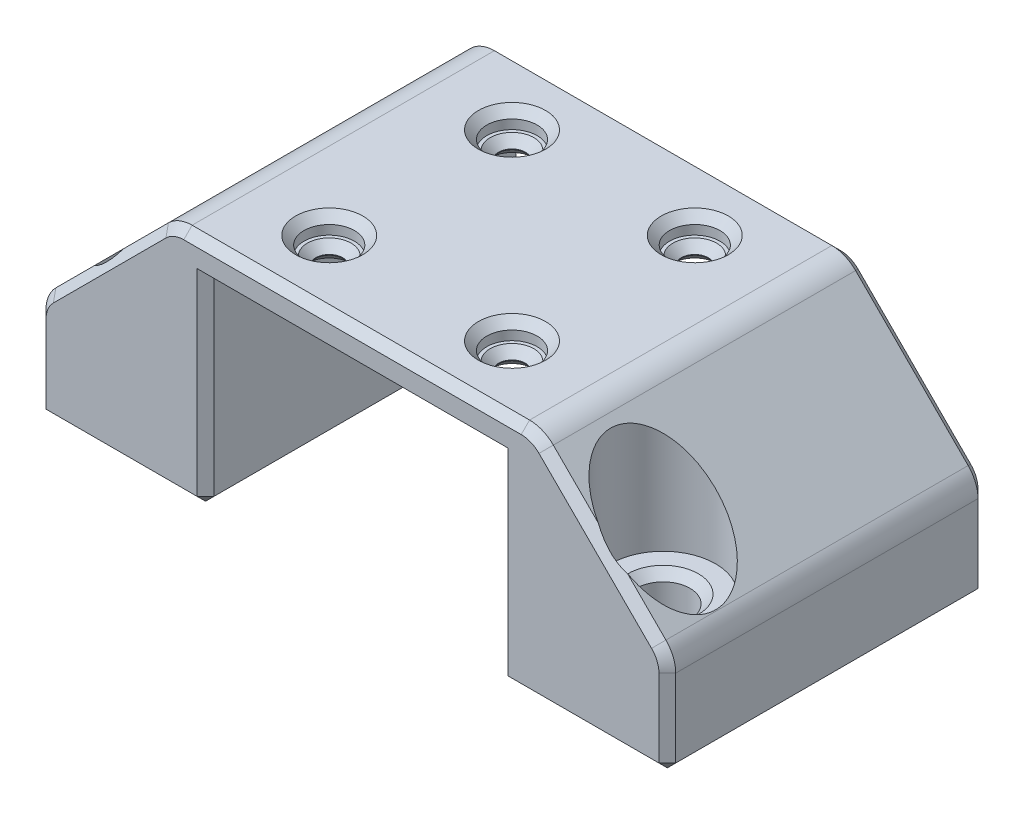
from build123d import *

# Parameters (mm, degrees)
BOSS_EXTRUDE1_DEPTH = 24.13
CHAMFER1_SIZE       = 10
FILLET1_R           = 2.54
FILLET2_R           = 2.54
SKETCH2_R           = 2.032
CUT_EXTRUDE1_DEPTH  = 10.16
SKETCH3_R           = 1.016
CUT_EXTRUDE2_DEPTH  = 39.185845946
SKETCH4_R           = 1.905
CUT_EXTRUDE3_DEPTH  = 1.3335
SKETCH5_R           = 2.032
CUT_EXTRUDE4_DEPTH  = 8.89
SKETCH7_R           = 3.96875
CUT_EXTRUDE5_DEPTH  = 10.16


with BuildPart() as part:
    # Sketch1 → Boss-Extrude1 (new body)
    with BuildSketch(Plane.XY):
        Polygon((-11.1125, 0), (-11.1125, 14.9225), (11.1125, 14.9225), (11.1125, 0), (23.8125, 0), (23.8125, 17.574605951), (-23.8125, 17.574605951), (-23.8125, 0), align=None)
    extrude(amount=BOSS_EXTRUDE1_DEPTH)

    # Chamfer1
    chamfer1_edges = [part.edges().sort_by_distance(p)[0] for p in [
        (-23.8125, 17.574605951, 12.065),
        (23.8125, 17.574605951, 12.065),
    ]]
    chamfer(chamfer1_edges, length=CHAMFER1_SIZE)

    # Fillet1
    fillet1_edges = [part.edges().sort_by_distance(p)[0] for p in [
        (-13.8125, 17.574605951, 12.065),
        (13.8125, 17.574605951, 12.065),
    ]]
    fillet(fillet1_edges, radius=FILLET1_R)

    # Fillet2
    fillet2_edges = [part.edges().sort_by_distance(p)[0] for p in [
        (23.8125, 7.574605951, 12.065),
        (-23.8125, 7.574605951, 12.065),
    ]]
    fillet(fillet2_edges, radius=FILLET2_R)

    # Sketch2 → Cut-Extrude1 (cut)
    with BuildSketch(Plane.XZ):
        with Locations((-19.05, 19.685)):
            Circle(SKETCH2_R)
        with Locations(Location((19.05, 19.685, 0), (0, 0, 180))):
            Circle(SKETCH2_R)
    extrude(amount=-CUT_EXTRUDE1_DEPTH, mode=Mode.SUBTRACT)

    # Sketch3 → Cut-Extrude2 (cut, through all)
    with BuildSketch(Plane(origin=(0, 17.574605951, 0), x_dir=(1, 0, 0), z_dir=(0, 1, 0))):
        with Locations(Location((-6.91134, -5.15366, 0), (0, 0, 270))):
            Circle(SKETCH3_R)
        with Locations(Location((6.91134, -5.15366, 0), (0, 0, 270))):
            Circle(SKETCH3_R)
        with Locations(Location((6.91134, -18.97634, 0), (0, 0, 270))):
            Circle(SKETCH3_R)
        with Locations(Location((-6.91134, -18.97634, 0), (0, 0, 270))):
            Circle(SKETCH3_R)
    extrude(amount=-CUT_EXTRUDE2_DEPTH, mode=Mode.SUBTRACT)

    # Sketch4 → Cut-Extrude3 (cut)
    with BuildSketch(Plane(origin=(0, 17.574605951, 0), x_dir=(1, 0, 0), z_dir=(0, 1, 0))):
        with Locations(Location((-6.91134, -5.15366, 0), (0, 0, 270))):
            Circle(SKETCH4_R)
        with Locations(Location((6.91134, -5.15366, 0), (0, 0, 90))):
            Circle(SKETCH4_R)
        with Locations(Location((6.91134, -18.97634, 0), (0, 0, 270))):
            Circle(SKETCH4_R)
        with Locations(Location((-6.91134, -18.97634, 0), (0, 0, 90))):
            Circle(SKETCH4_R)
    extrude(amount=-CUT_EXTRUDE3_DEPTH, mode=Mode.SUBTRACT)

    # Sketch5 → Cut-Extrude4 (cut)
    with BuildSketch(Plane.XZ):
        with Locations((-19.05, 4.445)):
            Circle(SKETCH5_R)
        with Locations(Location((19.05, 4.445, 0), (0, 0, 180))):
            Circle(SKETCH5_R)
    extrude(amount=-CUT_EXTRUDE4_DEPTH, mode=Mode.SUBTRACT)

    # Sketch7 → Cut-Extrude5 (cut)
    with BuildSketch(Plane(origin=(0, 17.574605951, 0), x_dir=(1, 0, 0), z_dir=(0, 1, 0))):
        with Locations(Location((19.05, -19.685, 0), (0, 0, 180))):
            Circle(SKETCH7_R)
        with Locations(Location((-19.05, -19.685, 0), (0, 0, 270))):
            Circle(SKETCH7_R)
    extrude(amount=-CUT_EXTRUDE5_DEPTH, mode=Mode.SUBTRACT)

    # Chamfer2
    # the kernel refuses this chamfer: 0.635 mm, written as the material it takes off along each edge
    with BuildSketch(Plane(origin=(11.535833333, 0.423333333, 0.423333333), x_dir=(-0.7071067811865474, 0, 0.7071067811865477), z_dir=(-0.5773502691896262, -0.5773502691896255, -0.5773502691896257)), Plane(origin=(-23.389166667, 0.423333333, 0.423333333), x_dir=(-0.7071067811865483, 0, 0.7071067811865467), z_dir=(-0.5773502691896246, -0.5773502691896265, -0.5773502691896262)), Plane(origin=(23.389166667, 0.423333333, 23.706666667), x_dir=(-0.7071067811865485, -0.7071067811865465, 0), z_dir=(0.5773502691896253, -0.577350269189627, 0.577350269189625)), Plane(origin=(-11.535833333, 0.423333333, 23.706666667), x_dir=(-0.7071067811865474, -0.7071067811865478, 0), z_dir=(0.5773502691896265, -0.5773502691896261, 0.5773502691896247))) as chamfer2_piece_1:
        Polygon((-0.449012806, 0.259237664), (0.449012806, 0.259237664), (0, -0.518475329), align=None)
    extrude(amount=0.806558326, mode=Mode.SUBTRACT)
    with BuildSketch(Plane(origin=(-11.535833333, 0.423333333, 0.423333333), x_dir=(0.7071067811865474, 0, 0.7071067811865477), z_dir=(0.577350269189626, -0.5773502691896255, -0.5773502691896257)), Plane(origin=(-23.389166667, 0.423333333, 23.706666667), x_dir=(0.7071067811865488, -0.7071067811865462, 0), z_dir=(-0.5773502691896251, -0.5773502691896272, 0.5773502691896251)), Plane(origin=(23.389166667, 0.423333333, 0.423333333), x_dir=(0.7071067811865483, 0, 0.7071067811865466), z_dir=(0.5773502691896248, -0.5773502691896265, -0.577350269189626)), Plane(origin=(11.535833333, 0.423333333, 23.706666667), x_dir=(0.7071067811865471, -0.7071067811865479, 0), z_dir=(-0.5773502691896265, -0.5773502691896258, 0.5773502691896248))) as chamfer2_piece_2:
        Polygon((-0.449012806, -0.259237664), (0.449012806, -0.259237664), (0, 0.518475329), align=None)
    extrude(amount=0.806558326, mode=Mode.SUBTRACT)
    with BuildSketch(Plane(origin=(11.1125, 14.9225, 0), x_dir=(0.9996219169112968, 0, -0.02749587661058637), z_dir=(0, -1, 0)), Plane(origin=(-11.1125, -1.633018697, 0), x_dir=(-0.9996219169112968, 0, -0.02749587661058637), z_dir=(0, 1, 0)), Plane(origin=(11.1125, 14.9225, 24.13), x_dir=(-0.027495876610587267, 0, -0.9996219169112966), z_dir=(0, -1, 0)), Plane(origin=(-11.1125, -1.633018697, 24.13), x_dir=(0.027495876610587267, 0, -0.9996219169112966), z_dir=(0, 1, 0))) as chamfer2_piece_3:
        with BuildLine():
            Line((0.653207479, 0), (-0.035907443, 0.652219799))
            Line((-0.035907443, 0.652219799), (-0.048602642, 0.651870601))
            ThreePointArc((-0.048602642, 0.651870601), (-0.021672059, 0.326007622), (-0.012695198, -0.000349198))
            Line((-0.012695198, -0.000349198), (0.000349198, -0.012695198))
            ThreePointArc((0.000349198, -0.012695198), (0.326706017, -0.003718338), (0.653556677, -0.012695198))
            Line((0.653556677, -0.012695198), (0.653207479, 0))
        make_face()
    extrude(amount=16.555518697, mode=Mode.SUBTRACT)
    with BuildSketch(Plane(origin=(-6.91134, 16.241105951, 18.97634), x_dir=(0, 0, 1), z_dir=(-1, 0, 0))) as chamfer2_piece_4:
        with BuildLine():
            Line((0.998039488, -0.652960512), (1.668960512, 0.017960512))
            Line((1.668960512, 0.017960512), (1.668960512, 0.030660512))
            ThreePointArc((1.668960512, 0.030660512), (1.342480256, 0.0127), (1.016, 0.0127))
            Line((1.016, 0.0127), (1.0033, 0))
            ThreePointArc((1.0033, 0), (1.0033, -0.326480256), (0.985339488, -0.652960512))
            Line((0.985339488, -0.652960512), (0.998039488, -0.652960512))
        make_face()
    revolve(axis=Axis((-6.91134, 16.241105951, 18.97634), (0, 1, 0)), mode=Mode.SUBTRACT)
    with BuildSketch(Plane(origin=(-6.91134, 17.574605951, 18.97634), x_dir=(0, 0, -1), z_dir=(1, 0, 0))) as chamfer2_piece_5:
        with BuildLine():
            Line((2.557960512, 0.017960512), (1.887039488, -0.652960512))
            Line((1.887039488, -0.652960512), (1.874339488, -0.652960512))
            ThreePointArc((1.874339488, -0.652960512), (1.8923, -0.326480256), (1.8923, 0))
            Line((1.8923, 0), (1.905, 0.0127))
            ThreePointArc((1.905, 0.0127), (2.231480256, 0.0127), (2.557960512, 0.030660512))
            Line((2.557960512, 0.030660512), (2.557960512, 0.017960512))
        make_face()
    revolve(axis=Axis((-6.91134, 17.574605951, 18.97634), (0, 1, 0)), mode=Mode.SUBTRACT)
    with BuildSketch(Plane(origin=(6.91134, 17.574605951, 18.97634), x_dir=(0, 0, 1), z_dir=(-1, 0, 0))) as chamfer2_piece_6:
        with BuildLine():
            Line((2.557960512, 0.017960512), (1.887039488, -0.652960512))
            Line((1.887039488, -0.652960512), (1.874339488, -0.652960512))
            ThreePointArc((1.874339488, -0.652960512), (1.8923, -0.326480256), (1.8923, 0))
            Line((1.8923, 0), (1.905, 0.0127))
            ThreePointArc((1.905, 0.0127), (2.231480256, 0.0127), (2.557960512, 0.030660512))
            Line((2.557960512, 0.030660512), (2.557960512, 0.017960512))
        make_face()
    revolve(axis=Axis((6.91134, 17.574605951, 18.97634), (0, 1, 0)), mode=Mode.SUBTRACT)
    with BuildSketch(Plane(origin=(-11.1125, 14.9225, 0), x_dir=(0, 0.9996219169112968, -0.02749587661058637), z_dir=(1, 0, 0)), Plane(origin=(-11.1125, 14.9225, 24.13), x_dir=(0, -0.027495876610587267, -0.9996219169112966), z_dir=(1, 0, 0))) as chamfer2_piece_7:
        with BuildLine():
            Line((0.653207479, 0), (-0.035907443, 0.652219799))
            Line((-0.035907443, 0.652219799), (-0.048602642, 0.651870601))
            ThreePointArc((-0.048602642, 0.651870601), (-0.021672059, 0.326007622), (-0.012695198, -0.000349198))
            Line((-0.012695198, -0.000349198), (0.000349198, -0.012695198))
            ThreePointArc((0.000349198, -0.012695198), (0.326706017, -0.003718338), (0.653556677, -0.012695198))
            Line((0.653556677, -0.012695198), (0.653207479, 0))
        make_face()
    extrude(amount=22.225, mode=Mode.SUBTRACT)
    with BuildSketch(Plane(origin=(6.91134, 16.241105951, 18.97634), x_dir=(0, 0, 1), z_dir=(-1, 0, 0))) as chamfer2_piece_8:
        with BuildLine():
            Line((0.998039488, -0.652960512), (1.668960512, 0.017960512))
            Line((1.668960512, 0.017960512), (1.668960512, 0.030660512))
            ThreePointArc((1.668960512, 0.030660512), (1.342480256, 0.0127), (1.016, 0.0127))
            Line((1.016, 0.0127), (1.0033, 0))
            ThreePointArc((1.0033, 0), (1.0033, -0.326480256), (0.985339488, -0.652960512))
            Line((0.985339488, -0.652960512), (0.998039488, -0.652960512))
        make_face()
    revolve(axis=Axis((6.91134, 16.241105951, 18.97634), (0, 1, 0)), mode=Mode.SUBTRACT)
    with BuildSketch(Plane(origin=(6.91134, 16.241105951, 5.15366), x_dir=(0, 0, 1), z_dir=(-1, 0, 0))) as chamfer2_piece_9:
        with BuildLine():
            Line((0.998039488, -0.652960512), (1.668960512, 0.017960512))
            Line((1.668960512, 0.017960512), (1.668960512, 0.030660512))
            ThreePointArc((1.668960512, 0.030660512), (1.342480256, 0.0127), (1.016, 0.0127))
            Line((1.016, 0.0127), (1.0033, 0))
            ThreePointArc((1.0033, 0), (1.0033, -0.326480256), (0.985339488, -0.652960512))
            Line((0.985339488, -0.652960512), (0.998039488, -0.652960512))
        make_face()
    revolve(axis=Axis((6.91134, 16.241105951, 5.15366), (0, 1, 0)), mode=Mode.SUBTRACT)
    with BuildSketch(Plane(origin=(6.91134, 17.574605951, 5.15366), x_dir=(0, 0, -1), z_dir=(1, 0, 0))) as chamfer2_piece_10:
        with BuildLine():
            Line((2.557960512, 0.017960512), (1.887039488, -0.652960512))
            Line((1.887039488, -0.652960512), (1.874339488, -0.652960512))
            ThreePointArc((1.874339488, -0.652960512), (1.8923, -0.326480256), (1.8923, 0))
            Line((1.8923, 0), (1.905, 0.0127))
            ThreePointArc((1.905, 0.0127), (2.231480256, 0.0127), (2.557960512, 0.030660512))
            Line((2.557960512, 0.030660512), (2.557960512, 0.017960512))
        make_face()
    revolve(axis=Axis((6.91134, 17.574605951, 5.15366), (0, 1, 0)), mode=Mode.SUBTRACT)
    with BuildSketch(Plane(origin=(-6.91134, 17.574605951, 5.15366), x_dir=(0, 0, 1), z_dir=(-1, 0, 0))) as chamfer2_piece_11:
        with BuildLine():
            Line((2.557960512, 0.017960512), (1.887039488, -0.652960512))
            Line((1.887039488, -0.652960512), (1.874339488, -0.652960512))
            ThreePointArc((1.874339488, -0.652960512), (1.8923, -0.326480256), (1.8923, 0))
            Line((1.8923, 0), (1.905, 0.0127))
            ThreePointArc((1.905, 0.0127), (2.231480256, 0.0127), (2.557960512, 0.030660512))
            Line((2.557960512, 0.030660512), (2.557960512, 0.017960512))
        make_face()
    revolve(axis=Axis((-6.91134, 17.574605951, 5.15366), (0, 1, 0)), mode=Mode.SUBTRACT)
    with BuildSketch(Plane(origin=(-6.91134, 16.241105951, 5.15366), x_dir=(0, 0, 1), z_dir=(-1, 0, 0))) as chamfer2_piece_12:
        with BuildLine():
            Line((0.998039488, -0.652960512), (1.668960512, 0.017960512))
            Line((1.668960512, 0.017960512), (1.668960512, 0.030660512))
            ThreePointArc((1.668960512, 0.030660512), (1.342480256, 0.0127), (1.016, 0.0127))
            Line((1.016, 0.0127), (1.0033, 0))
            ThreePointArc((1.0033, 0), (1.0033, -0.326480256), (0.985339488, -0.652960512))
            Line((0.985339488, -0.652960512), (0.998039488, -0.652960512))
        make_face()
    revolve(axis=Axis((-6.91134, 16.241105951, 5.15366), (0, 1, 0)), mode=Mode.SUBTRACT)
    with BuildSketch(Plane(origin=(-25.445518697, 0, 0), x_dir=(0, 0.9996219169112968, -0.027495876610586386), z_dir=(1, 0, 0)), Plane(origin=(9.479481303, 0, 24.13), x_dir=(0, -0.02749587661058632, -0.9996219169112968), z_dir=(1, 0, 0)), Plane(origin=(-25.445518697, 0, 24.13), x_dir=(0, -0.02749587661058632, -0.9996219169112968), z_dir=(1, 0, 0)), Plane(origin=(9.479481303, 0, 0), x_dir=(0, 0.9996219169112968, -0.02749587661058639), z_dir=(1, 0, 0))) as chamfer2_piece_13:
        with BuildLine():
            Line((0.653207479, 0), (-0.035907443, 0.652219799))
            Line((-0.035907443, 0.652219799), (-0.048602642, 0.651870601))
            ThreePointArc((-0.048602642, 0.651870601), (-0.021672059, 0.326007622), (-0.012695198, -0.000349198))
            Line((-0.012695198, -0.000349198), (0.000349198, -0.012695198))
            ThreePointArc((0.000349198, -0.012695198), (0.326706017, -0.003718338), (0.653556677, -0.012695198))
            Line((0.653556677, -0.012695198), (0.653207479, 0))
        make_face()
    extrude(amount=15.966037395, mode=Mode.SUBTRACT)
    with BuildSketch(Plane(origin=(-19.05, 0, 4.445), x_dir=(1, 0, 0), z_dir=(0, 0, -1))) as chamfer2_piece_14:
        with BuildLine():
            Line((2.684960512, 0.017960512), (2.014039488, -0.652960512))
            Line((2.014039488, -0.652960512), (2.001339488, -0.652960512))
            ThreePointArc((2.001339488, -0.652960512), (2.0193, -0.326480256), (2.0193, 0))
            Line((2.0193, 0), (2.032, 0.0127))
            ThreePointArc((2.032, 0.0127), (2.358480256, 0.0127), (2.684960512, 0.030660512))
            Line((2.684960512, 0.030660512), (2.684960512, 0.017960512))
        make_face()
    revolve(axis=Axis((-19.05, 0, 4.445), (0, -1, 0)), mode=Mode.SUBTRACT)
    with BuildSketch(Plane(origin=(19.05, 0, 4.445), x_dir=(-1, 0, 0), z_dir=(0, 0, 1))) as chamfer2_piece_15:
        with BuildLine():
            Line((2.684960512, 0.017960512), (2.014039488, -0.652960512))
            Line((2.014039488, -0.652960512), (2.001339488, -0.652960512))
            ThreePointArc((2.001339488, -0.652960512), (2.0193, -0.326480256), (2.0193, 0))
            Line((2.0193, 0), (2.032, 0.0127))
            ThreePointArc((2.032, 0.0127), (2.358480256, 0.0127), (2.684960512, 0.030660512))
            Line((2.684960512, 0.030660512), (2.684960512, 0.017960512))
        make_face()
    revolve(axis=Axis((19.05, 0, 4.445), (0, -1, 0)), mode=Mode.SUBTRACT)
    with BuildSketch(Plane(origin=(19.05, 7.414605951, 19.685), x_dir=(-1, 0, 0), z_dir=(0, 0, 1))) as chamfer2_piece_16:
        with BuildLine():
            Line((2.014039488, 0.652960512), (2.684960512, -0.017960512))
            Line((2.684960512, -0.017960512), (2.684960512, -0.030660512))
            ThreePointArc((2.684960512, -0.030660512), (2.358480256, -0.0127), (2.032, -0.0127))
            Line((2.032, -0.0127), (2.0193, 0))
            ThreePointArc((2.0193, 0), (2.0193, 0.326480256), (2.001339488, 0.652960512))
            Line((2.001339488, 0.652960512), (2.014039488, 0.652960512))
        make_face()
    revolve(axis=Axis((19.05, 7.414605951, 19.685), (0, -1, 0)), mode=Mode.SUBTRACT)
    with BuildSketch(Plane(origin=(-19.05, 7.414605951, 19.685), x_dir=(1, 0, 0), z_dir=(0, 0, -1))) as chamfer2_piece_17:
        with BuildLine():
            Line((2.014039488, 0.652960512), (2.684960512, -0.017960512))
            Line((2.684960512, -0.017960512), (2.684960512, -0.030660512))
            ThreePointArc((2.684960512, -0.030660512), (2.358480256, -0.0127), (2.032, -0.0127))
            Line((2.032, -0.0127), (2.0193, 0))
            ThreePointArc((2.0193, 0), (2.0193, 0.326480256), (2.001339488, 0.652960512))
            Line((2.001339488, 0.652960512), (2.014039488, 0.652960512))
        make_face()
    revolve(axis=Axis((-19.05, 7.414605951, 19.685), (0, -1, 0)), mode=Mode.SUBTRACT)
    with BuildSketch(Plane(origin=(-23.8125, 0, -1.633018697), x_dir=(-0.0274958766105845, 0.9996219169112968, 0), z_dir=(0, 0, 1))) as chamfer2_piece_18:
        with BuildLine():
            Line((0.653207479, 0), (-0.035907443, -0.652219799))
            Line((-0.035907443, -0.652219799), (-0.048602642, -0.651870601))
            ThreePointArc((-0.048602642, -0.651870601), (-0.021672059, -0.326007622), (-0.012695198, 0.000349198))
            Line((-0.012695198, 0.000349198), (0.000349198, 0.012695198))
            ThreePointArc((0.000349198, 0.012695198), (0.326706017, 0.003718338), (0.653556677, 0.012695198))
            Line((0.653556677, 0.012695198), (0.653207479, 0))
        make_face()
    extrude(amount=27.396037395, mode=Mode.SUBTRACT)
    with BuildSketch(Plane(origin=(23.8125, 0, -1.633018697), x_dir=(0.027495876610584568, 0.9996219169112968, 0), z_dir=(0, 0, 1)), Plane(origin=(11.1125, 0, -1.633018697), x_dir=(0.9996219169112968, -0.02749587661058659, 0), z_dir=(0, 0, 1)), Plane(origin=(-11.1125, 0, -1.633018697), x_dir=(0.02749587661058728, 0.9996219169112966, 0), z_dir=(0, 0, 1))) as chamfer2_piece_19:
        with BuildLine():
            Line((0.653207479, 0), (-0.035907443, 0.652219799))
            Line((-0.035907443, 0.652219799), (-0.048602642, 0.651870601))
            ThreePointArc((-0.048602642, 0.651870601), (-0.021672059, 0.326007622), (-0.012695198, -0.000349198))
            Line((-0.012695198, -0.000349198), (0.000349198, -0.012695198))
            ThreePointArc((0.000349198, -0.012695198), (0.326706017, -0.003718338), (0.653556677, -0.012695198))
            Line((0.653556677, -0.012695198), (0.653207479, 0))
        make_face()
    extrude(amount=27.396037395, mode=Mode.SUBTRACT)
    with BuildSketch(Plane(origin=(23.8125, -1.633018697, 24.13), x_dir=(0.02749587661058455, 0, -0.9996219169112968), z_dir=(0, 1, 0)), Plane(origin=(-23.8125, 6.522503503, 24.13), x_dir=(-0.02749587661058455, 0, -0.9996219169112968), z_dir=(0, -1, 0)), Plane(origin=(-23.8125, 6.522503503, 0), x_dir=(0.9996219169112968, 0, -0.027495876610586324), z_dir=(0, -1, 0)), Plane(origin=(23.8125, -1.633018697, 0), x_dir=(-0.9996219169112968, 0, -0.027495876610586324), z_dir=(0, 1, 0))) as chamfer2_piece_20:
        with BuildLine():
            Line((0.653207479, 0), (-0.035907443, 0.652219799))
            Line((-0.035907443, 0.652219799), (-0.048602642, 0.651870601))
            ThreePointArc((-0.048602642, 0.651870601), (-0.021672059, 0.326007622), (-0.012695198, -0.000349198))
            Line((-0.012695198, -0.000349198), (0.000349198, -0.012695198))
            ThreePointArc((0.000349198, -0.012695198), (0.326706017, -0.003718338), (0.653556677, -0.012695198))
            Line((0.653556677, -0.012695198), (0.653207479, 0))
        make_face()
    extrude(amount=8.1555222, mode=Mode.SUBTRACT)
    with BuildSketch(Plane(origin=(12.760397552, 17.574605951, 24.13), x_dir=(0, 0.02749587661058455, -0.9996219169112968), z_dir=(-1, 0, 0)), Plane(origin=(12.760397552, 17.574605951, 0), x_dir=(0, -0.9996219169112968, -0.027495876610586324), z_dir=(-1, 0, 0))) as chamfer2_piece_21:
        with BuildLine():
            Line((0.653207479, 0), (-0.035907443, 0.652219799))
            Line((-0.035907443, 0.652219799), (-0.048602642, 0.651870601))
            ThreePointArc((-0.048602642, 0.651870601), (-0.021672059, 0.326007622), (-0.012695198, -0.000349198))
            Line((-0.012695198, -0.000349198), (0.000349198, -0.012695198))
            ThreePointArc((0.000349198, -0.012695198), (0.326706017, -0.003718338), (0.653556677, -0.012695198))
            Line((0.653556677, -0.012695198), (0.653207479, 0))
        make_face()
    extrude(amount=25.520795103, mode=Mode.SUBTRACT)
    with BuildSketch(Plane(origin=(23.068551224, 8.318554727, 0), x_dir=(-0.7068394360706735, -0.7068394360706735, -0.027495876610586473), z_dir=(-0.7071067811865476, 0.7071067811865476, 0)), Plane(origin=(-14.556448776, 16.830657175, 24.13), x_dir=(-0.01944252080601511, 0.01944252080601511, -0.9996219169112966), z_dir=(-0.7071067811865476, -0.7071067811865476, 0)), Plane(origin=(23.068551224, 8.318554727, 24.13), x_dir=(0.019442520806013754, 0.019442520806013754, -0.9996219169112968), z_dir=(-0.7071067811865476, 0.7071067811865476, 0)), Plane(origin=(-14.556448776, 16.830657175, 0), x_dir=(0.7068394360706735, -0.7068394360706735, -0.02749587661058638), z_dir=(-0.7071067811865476, -0.7071067811865476, 0))) as chamfer2_piece_22:
        with BuildLine():
            Line((0.653207479, 0), (-0.035907443, 0.652219799))
            Line((-0.035907443, 0.652219799), (-0.048602642, 0.651870601))
            ThreePointArc((-0.048602642, 0.651870601), (-0.021672059, 0.326007622), (-0.012695198, -0.000349198))
            Line((-0.012695198, -0.000349198), (0.000349198, -0.012695198))
            ThreePointArc((0.000349198, -0.012695198), (0.326706017, -0.003718338), (0.653556677, -0.012695198))
            Line((0.653556677, -0.012695198), (0.653207479, 0))
        make_face()
    extrude(amount=12.037930727, mode=Mode.SUBTRACT)
    with BuildSketch(Plane(origin=(-12.760397552, 15.034605951, 0), x_dir=(0, 1, 0), z_dir=(1, 0, 0))) as chamfer2_piece_23:
        with BuildLine():
            Line((1.887039488, -0.017960512), (2.557960512, 0.652960512))
            Line((2.557960512, 0.652960512), (2.570660512, 0.652960512))
            ThreePointArc((2.570660512, 0.652960512), (2.5527, 0.326480256), (2.5527, 0))
            Line((2.5527, 0), (2.54, -0.0127))
            ThreePointArc((2.54, -0.0127), (2.213519744, -0.0127), (1.887039488, -0.030660512))
            Line((1.887039488, -0.030660512), (1.887039488, -0.017960512))
        make_face()
    revolve(axis=Axis((-12.760397552, 15.034605951, 0), (0, 0, 1)), revolution_arc=45, mode=Mode.SUBTRACT)
    with BuildSketch(Plane(origin=(12.760397552, 15.034605951, 0), x_dir=(0.7071067811865478, 0.7071067811865471, 0), z_dir=(0.7071067811865471, -0.7071067811865478, 0))) as chamfer2_piece_24:
        with BuildLine():
            Line((1.887039488, -0.017960512), (2.557960512, 0.652960512))
            Line((2.557960512, 0.652960512), (2.570660512, 0.652960512))
            ThreePointArc((2.570660512, 0.652960512), (2.5527, 0.326480256), (2.5527, 0))
            Line((2.5527, 0), (2.54, -0.0127))
            ThreePointArc((2.54, -0.0127), (2.213519744, -0.0127), (1.887039488, -0.030660512))
            Line((1.887039488, -0.030660512), (1.887039488, -0.017960512))
        make_face()
    revolve(axis=Axis((12.760397552, 15.034605951, 0), (0, 0, 1)), revolution_arc=45, mode=Mode.SUBTRACT)
    with BuildSketch(Plane(origin=(-12.760397552, 15.034605951, 24.13), x_dir=(0, 1, 0), z_dir=(1, 0, 0))) as chamfer2_piece_25:
        with BuildLine():
            Line((2.557960512, -0.652960512), (1.887039488, 0.017960512))
            Line((1.887039488, 0.017960512), (1.887039488, 0.030660512))
            ThreePointArc((1.887039488, 0.030660512), (2.213519744, 0.0127), (2.54, 0.0127))
            Line((2.54, 0.0127), (2.5527, 0))
            ThreePointArc((2.5527, 0), (2.5527, -0.326480256), (2.570660512, -0.652960512))
            Line((2.570660512, -0.652960512), (2.557960512, -0.652960512))
        make_face()
    revolve(axis=Axis((-12.760397552, 15.034605951, 24.13), (0, 0, 1)), revolution_arc=45, mode=Mode.SUBTRACT)
    with BuildSketch(Plane(origin=(12.760397552, 15.034605951, 24.13), x_dir=(0.7071067811865478, 0.7071067811865471, 0), z_dir=(0.7071067811865471, -0.7071067811865478, 0))) as chamfer2_piece_26:
        with BuildLine():
            Line((2.557960512, -0.652960512), (1.887039488, 0.017960512))
            Line((1.887039488, 0.017960512), (1.887039488, 0.030660512))
            ThreePointArc((1.887039488, 0.030660512), (2.213519744, 0.0127), (2.54, 0.0127))
            Line((2.54, 0.0127), (2.5527, 0))
            ThreePointArc((2.5527, 0), (2.5527, -0.326480256), (2.570660512, -0.652960512))
            Line((2.570660512, -0.652960512), (2.557960512, -0.652960512))
        make_face()
    revolve(axis=Axis((12.760397552, 15.034605951, 24.13), (0, 0, 1)), revolution_arc=45, mode=Mode.SUBTRACT)
    with BuildSketch(Plane(origin=(-21.2725, 6.522503503, 24.13), x_dir=(-0.7071067811865472, 0.7071067811865479, 0), z_dir=(0.7071067811865479, 0.7071067811865472, 0))) as chamfer2_piece_27:
        with BuildLine():
            Line((2.557960512, -0.652960512), (1.887039488, 0.017960512))
            Line((1.887039488, 0.017960512), (1.887039488, 0.030660512))
            ThreePointArc((1.887039488, 0.030660512), (2.213519744, 0.0127), (2.54, 0.0127))
            Line((2.54, 0.0127), (2.5527, 0))
            ThreePointArc((2.5527, 0), (2.5527, -0.326480256), (2.570660512, -0.652960512))
            Line((2.570660512, -0.652960512), (2.557960512, -0.652960512))
        make_face()
    revolve(axis=Axis((-21.2725, 6.522503503, 24.13), (0, 0, 1)), revolution_arc=45, mode=Mode.SUBTRACT)
    with BuildSketch(Plane(origin=(21.2725, 6.522503503, 24.13), x_dir=(0.7071067811865474, 0.7071067811865477, 0), z_dir=(-0.7071067811865477, 0.7071067811865474, 0))) as chamfer2_piece_28:
        with BuildLine():
            Line((2.557960512, 0.652960512), (1.887039488, -0.017960512))
            Line((1.887039488, -0.017960512), (1.887039488, -0.030660512))
            ThreePointArc((1.887039488, -0.030660512), (2.213519744, -0.0127), (2.54, -0.0127))
            Line((2.54, -0.0127), (2.5527, 0))
            ThreePointArc((2.5527, 0), (2.5527, 0.326480256), (2.570660512, 0.652960512))
            Line((2.570660512, 0.652960512), (2.557960512, 0.652960512))
        make_face()
    revolve(axis=Axis((21.2725, 6.522503503, 24.13), (0, 0, -1)), revolution_arc=45, mode=Mode.SUBTRACT)
    with BuildSketch(Plane(origin=(-21.2725, 6.522503503, 0), x_dir=(-0.7071067811865472, 0.7071067811865479, 0), z_dir=(0.7071067811865479, 0.7071067811865472, 0))) as chamfer2_piece_29:
        with BuildLine():
            Line((1.887039488, -0.017960512), (2.557960512, 0.652960512))
            Line((2.557960512, 0.652960512), (2.570660512, 0.652960512))
            ThreePointArc((2.570660512, 0.652960512), (2.5527, 0.326480256), (2.5527, 0))
            Line((2.5527, 0), (2.54, -0.0127))
            ThreePointArc((2.54, -0.0127), (2.213519744, -0.0127), (1.887039488, -0.030660512))
            Line((1.887039488, -0.030660512), (1.887039488, -0.017960512))
        make_face()
    revolve(axis=Axis((-21.2725, 6.522503503, 0), (0, 0, 1)), revolution_arc=45, mode=Mode.SUBTRACT)
    with BuildSketch(Plane(origin=(21.2725, 6.522503503, 0), x_dir=(0.7071067811865474, 0.7071067811865477, 0), z_dir=(-0.7071067811865477, 0.7071067811865474, 0))) as chamfer2_piece_30:
        with BuildLine():
            Line((1.887039488, 0.017960512), (2.557960512, -0.652960512))
            Line((2.557960512, -0.652960512), (2.570660512, -0.652960512))
            ThreePointArc((2.570660512, -0.652960512), (2.5527, -0.326480256), (2.5527, 0))
            Line((2.5527, 0), (2.54, 0.0127))
            ThreePointArc((2.54, 0.0127), (2.213519744, 0.0127), (1.887039488, 0.030660512))
            Line((1.887039488, 0.030660512), (1.887039488, 0.017960512))
        make_face()
    revolve(axis=Axis((21.2725, 6.522503503, 0), (0, 0, -1)), revolution_arc=45, mode=Mode.SUBTRACT)
    with BuildSketch(Plane(origin=(-19.05, 0, 19.685), x_dir=(1, 0, 0), z_dir=(0, 0, -1))) as chamfer2_piece_31:
        with BuildLine():
            Line((2.684960512, 0.017960512), (2.014039488, -0.652960512))
            Line((2.014039488, -0.652960512), (2.001339488, -0.652960512))
            ThreePointArc((2.001339488, -0.652960512), (2.0193, -0.326480256), (2.0193, 0))
            Line((2.0193, 0), (2.032, 0.0127))
            ThreePointArc((2.032, 0.0127), (2.358480256, 0.0127), (2.684960512, 0.030660512))
            Line((2.684960512, 0.030660512), (2.684960512, 0.017960512))
        make_face()
    revolve(axis=Axis((-19.05, 0, 19.685), (0, -1, 0)), mode=Mode.SUBTRACT)
    with BuildSketch(Plane(origin=(19.05, 0, 19.685), x_dir=(-1, 0, 0), z_dir=(0, 0, 1))) as chamfer2_piece_32:
        with BuildLine():
            Line((2.684960512, 0.017960512), (2.014039488, -0.652960512))
            Line((2.014039488, -0.652960512), (2.001339488, -0.652960512))
            ThreePointArc((2.001339488, -0.652960512), (2.0193, -0.326480256), (2.0193, 0))
            Line((2.0193, 0), (2.032, 0.0127))
            ThreePointArc((2.032, 0.0127), (2.358480256, 0.0127), (2.684960512, 0.030660512))
            Line((2.684960512, 0.030660512), (2.684960512, 0.017960512))
        make_face()
    revolve(axis=Axis((19.05, 0, 19.685), (0, -1, 0)), mode=Mode.SUBTRACT)
    with BuildSketch(Plane(origin=(-6.91134, 14.9225, 18.97634), x_dir=(0, 0, 1), z_dir=(-1, 0, 0))) as chamfer2_piece_33:
        with BuildLine():
            Line((1.668960512, -0.017960512), (0.998039488, 0.652960512))
            Line((0.998039488, 0.652960512), (0.985339488, 0.652960512))
            ThreePointArc((0.985339488, 0.652960512), (1.0033, 0.326480256), (1.0033, 0))
            Line((1.0033, 0), (1.016, -0.0127))
            ThreePointArc((1.016, -0.0127), (1.342480256, -0.0127), (1.668960512, -0.030660512))
            Line((1.668960512, -0.030660512), (1.668960512, -0.017960512))
        make_face()
    revolve(axis=Axis((-6.91134, 14.9225, 18.97634), (0, 1, 0)), mode=Mode.SUBTRACT)
    with BuildSketch(Plane(origin=(6.91134, 14.9225, 18.97634), x_dir=(0, 0, 1), z_dir=(-1, 0, 0))) as chamfer2_piece_34:
        with BuildLine():
            Line((1.668960512, -0.017960512), (0.998039488, 0.652960512))
            Line((0.998039488, 0.652960512), (0.985339488, 0.652960512))
            ThreePointArc((0.985339488, 0.652960512), (1.0033, 0.326480256), (1.0033, 0))
            Line((1.0033, 0), (1.016, -0.0127))
            ThreePointArc((1.016, -0.0127), (1.342480256, -0.0127), (1.668960512, -0.030660512))
            Line((1.668960512, -0.030660512), (1.668960512, -0.017960512))
        make_face()
    revolve(axis=Axis((6.91134, 14.9225, 18.97634), (0, 1, 0)), mode=Mode.SUBTRACT)
    with BuildSketch(Plane(origin=(6.91134, 14.9225, 5.15366), x_dir=(0, 0, 1), z_dir=(-1, 0, 0))) as chamfer2_piece_35:
        with BuildLine():
            Line((1.668960512, -0.017960512), (0.998039488, 0.652960512))
            Line((0.998039488, 0.652960512), (0.985339488, 0.652960512))
            ThreePointArc((0.985339488, 0.652960512), (1.0033, 0.326480256), (1.0033, 0))
            Line((1.0033, 0), (1.016, -0.0127))
            ThreePointArc((1.016, -0.0127), (1.342480256, -0.0127), (1.668960512, -0.030660512))
            Line((1.668960512, -0.030660512), (1.668960512, -0.017960512))
        make_face()
    revolve(axis=Axis((6.91134, 14.9225, 5.15366), (0, 1, 0)), mode=Mode.SUBTRACT)
    with BuildSketch(Plane(origin=(-6.91134, 14.9225, 5.15366), x_dir=(0, 0, 1), z_dir=(-1, 0, 0))) as chamfer2_piece_36:
        with BuildLine():
            Line((1.668960512, -0.017960512), (0.998039488, 0.652960512))
            Line((0.998039488, 0.652960512), (0.985339488, 0.652960512))
            ThreePointArc((0.985339488, 0.652960512), (1.0033, 0.326480256), (1.0033, 0))
            Line((1.0033, 0), (1.016, -0.0127))
            ThreePointArc((1.016, -0.0127), (1.342480256, -0.0127), (1.668960512, -0.030660512))
            Line((1.668960512, -0.030660512), (1.668960512, -0.017960512))
        make_face()
    revolve(axis=Axis((-6.91134, 14.9225, 5.15366), (0, 1, 0)), mode=Mode.SUBTRACT)
    with BuildSketch(Plane(origin=(11.1125, 16.555518697, 0), x_dir=(0.9996219169112968, 0, -0.02749587661058637), z_dir=(0, -1, 0))) as chamfer2_piece_37a_section:
        with BuildLine():
            Line((0.653207479, 0), (-0.035907443, 0.652219799))
            Line((-0.035907443, 0.652219799), (-0.048602642, 0.651870601))
            ThreePointArc((-0.048602642, 0.651870601), (-0.021672059, 0.326007622), (-0.012695198, -0.000349198))
            Line((-0.012695198, -0.000349198), (0.000349198, -0.012695198))
            ThreePointArc((0.000349198, -0.012695198), (0.326706017, -0.003718338), (0.653556677, -0.012695198))
            Line((0.653556677, -0.012695198), (0.653207479, 0))
        make_face()
    chamfer2_piece_37a = extrude(amount=18.188537395, mode=Mode.PRIVATE)
    chamfer2_piece_37a = split(chamfer2_piece_37a, bisect_by=Plane(origin=(11.321918953, 14.9225, 0.209418953), z_dir=(0, 1, 0)), keep=Keep.TOP, mode=Mode.PRIVATE)
    with BuildSketch(Plane(origin=(-11.1125, 14.9225, 0), x_dir=(0, 0.9996219169112968, -0.02749587661058637), z_dir=(1, 0, 0))) as chamfer2_piece_37b_section:
        with BuildLine():
            Line((0.653207479, 0), (-0.035907443, 0.652219799))
            Line((-0.035907443, 0.652219799), (-0.048602642, 0.651870601))
            ThreePointArc((-0.048602642, 0.651870601), (-0.021672059, 0.326007622), (-0.012695198, -0.000349198))
            Line((-0.012695198, -0.000349198), (0.000349198, -0.012695198))
            ThreePointArc((0.000349198, -0.012695198), (0.326706017, -0.003718338), (0.653556677, -0.012695198))
            Line((0.653556677, -0.012695198), (0.653207479, 0))
        make_face()
    chamfer2_piece_37b = extrude(amount=23.858018697, mode=Mode.PRIVATE)
    chamfer2_piece_37b = split(chamfer2_piece_37b, bisect_by=Plane(origin=(11.1125, 15.131918953, 0.209418953), z_dir=(1, 0, 0)), keep=Keep.TOP, mode=Mode.PRIVATE)
    chamfer2_piece_37 = chamfer2_piece_37a & chamfer2_piece_37b
    add(chamfer2_piece_37, mode=Mode.SUBTRACT)
    with BuildSketch(Plane(origin=(-12.745518697, 14.9225, 0), x_dir=(0, 0.9996219169112968, -0.02749587661058637), z_dir=(1, 0, 0))) as chamfer2_piece_38a_section:
        with BuildLine():
            Line((0.653207479, 0), (-0.035907443, 0.652219799))
            Line((-0.035907443, 0.652219799), (-0.048602642, 0.651870601))
            ThreePointArc((-0.048602642, 0.651870601), (-0.021672059, 0.326007622), (-0.012695198, -0.000349198))
            Line((-0.012695198, -0.000349198), (0.000349198, -0.012695198))
            ThreePointArc((0.000349198, -0.012695198), (0.326706017, -0.003718338), (0.653556677, -0.012695198))
            Line((0.653556677, -0.012695198), (0.653207479, 0))
        make_face()
    chamfer2_piece_38a = extrude(amount=23.858018697, mode=Mode.PRIVATE)
    chamfer2_piece_38a = split(chamfer2_piece_38a, bisect_by=Plane(origin=(-11.1125, 15.131918953, 0.209418953), z_dir=(-1, 0, 0)), keep=Keep.TOP, mode=Mode.PRIVATE)
    with BuildSketch(Plane(origin=(-11.1125, -1.633018697, 0), x_dir=(-0.9996219169112968, 0, -0.02749587661058637), z_dir=(0, 1, 0))) as chamfer2_piece_38b_section:
        with BuildLine():
            Line((0.653207479, 0), (-0.035907443, 0.652219799))
            Line((-0.035907443, 0.652219799), (-0.048602642, 0.651870601))
            ThreePointArc((-0.048602642, 0.651870601), (-0.021672059, 0.326007622), (-0.012695198, -0.000349198))
            Line((-0.012695198, -0.000349198), (0.000349198, -0.012695198))
            ThreePointArc((0.000349198, -0.012695198), (0.326706017, -0.003718338), (0.653556677, -0.012695198))
            Line((0.653556677, -0.012695198), (0.653207479, 0))
        make_face()
    chamfer2_piece_38b = extrude(amount=18.188537395, mode=Mode.PRIVATE)
    chamfer2_piece_38b = split(chamfer2_piece_38b, bisect_by=Plane(origin=(-11.321918953, 14.9225, 0.209418953), z_dir=(0, 1, 0)), keep=Keep.TOP, mode=Mode.PRIVATE)
    chamfer2_piece_38 = chamfer2_piece_38a & chamfer2_piece_38b
    add(chamfer2_piece_38, mode=Mode.SUBTRACT)
    with BuildSketch(Plane(origin=(-12.745518697, 14.9225, 24.13), x_dir=(0, -0.027495876610587267, -0.9996219169112966), z_dir=(1, 0, 0))) as chamfer2_piece_39a_section:
        with BuildLine():
            Line((0.653207479, 0), (-0.035907443, 0.652219799))
            Line((-0.035907443, 0.652219799), (-0.048602642, 0.651870601))
            ThreePointArc((-0.048602642, 0.651870601), (-0.021672059, 0.326007622), (-0.012695198, -0.000349198))
            Line((-0.012695198, -0.000349198), (0.000349198, -0.012695198))
            ThreePointArc((0.000349198, -0.012695198), (0.326706017, -0.003718338), (0.653556677, -0.012695198))
            Line((0.653556677, -0.012695198), (0.653207479, 0))
        make_face()
    chamfer2_piece_39a = extrude(amount=23.858018697, mode=Mode.PRIVATE)
    chamfer2_piece_39a = split(chamfer2_piece_39a, bisect_by=Plane(origin=(-11.1125, 15.131918953, 23.920581047), z_dir=(-1, 0, 0)), keep=Keep.TOP, mode=Mode.PRIVATE)
    with BuildSketch(Plane(origin=(-11.1125, -1.633018697, 24.13), x_dir=(0.027495876610587267, 0, -0.9996219169112966), z_dir=(0, 1, 0))) as chamfer2_piece_39b_section:
        with BuildLine():
            Line((0.653207479, 0), (-0.035907443, 0.652219799))
            Line((-0.035907443, 0.652219799), (-0.048602642, 0.651870601))
            ThreePointArc((-0.048602642, 0.651870601), (-0.021672059, 0.326007622), (-0.012695198, -0.000349198))
            Line((-0.012695198, -0.000349198), (0.000349198, -0.012695198))
            ThreePointArc((0.000349198, -0.012695198), (0.326706017, -0.003718338), (0.653556677, -0.012695198))
            Line((0.653556677, -0.012695198), (0.653207479, 0))
        make_face()
    chamfer2_piece_39b = extrude(amount=18.188537395, mode=Mode.PRIVATE)
    chamfer2_piece_39b = split(chamfer2_piece_39b, bisect_by=Plane(origin=(-11.321918953, 14.9225, 23.920581047), z_dir=(0, 1, 0)), keep=Keep.TOP, mode=Mode.PRIVATE)
    chamfer2_piece_39 = chamfer2_piece_39a & chamfer2_piece_39b
    add(chamfer2_piece_39, mode=Mode.SUBTRACT)
    with BuildSketch(Plane(origin=(11.1125, 16.555518697, 24.13), x_dir=(-0.027495876610587267, 0, -0.9996219169112966), z_dir=(0, -1, 0))) as chamfer2_piece_40a_section:
        with BuildLine():
            Line((0.653207479, 0), (-0.035907443, 0.652219799))
            Line((-0.035907443, 0.652219799), (-0.048602642, 0.651870601))
            ThreePointArc((-0.048602642, 0.651870601), (-0.021672059, 0.326007622), (-0.012695198, -0.000349198))
            Line((-0.012695198, -0.000349198), (0.000349198, -0.012695198))
            ThreePointArc((0.000349198, -0.012695198), (0.326706017, -0.003718338), (0.653556677, -0.012695198))
            Line((0.653556677, -0.012695198), (0.653207479, 0))
        make_face()
    chamfer2_piece_40a = extrude(amount=18.188537395, mode=Mode.PRIVATE)
    chamfer2_piece_40a = split(chamfer2_piece_40a, bisect_by=Plane(origin=(11.321918953, 14.9225, 23.920581047), z_dir=(0, 1, 0)), keep=Keep.TOP, mode=Mode.PRIVATE)
    with BuildSketch(Plane(origin=(-11.1125, 14.9225, 24.13), x_dir=(0, -0.027495876610587267, -0.9996219169112966), z_dir=(1, 0, 0))) as chamfer2_piece_40b_section:
        with BuildLine():
            Line((0.653207479, 0), (-0.035907443, 0.652219799))
            Line((-0.035907443, 0.652219799), (-0.048602642, 0.651870601))
            ThreePointArc((-0.048602642, 0.651870601), (-0.021672059, 0.326007622), (-0.012695198, -0.000349198))
            Line((-0.012695198, -0.000349198), (0.000349198, -0.012695198))
            ThreePointArc((0.000349198, -0.012695198), (0.326706017, -0.003718338), (0.653556677, -0.012695198))
            Line((0.653556677, -0.012695198), (0.653207479, 0))
        make_face()
    chamfer2_piece_40b = extrude(amount=23.858018697, mode=Mode.PRIVATE)
    chamfer2_piece_40b = split(chamfer2_piece_40b, bisect_by=Plane(origin=(11.1125, 15.131918953, 23.920581047), z_dir=(1, 0, 0)), keep=Keep.TOP, mode=Mode.PRIVATE)
    chamfer2_piece_40 = chamfer2_piece_40a & chamfer2_piece_40b
    add(chamfer2_piece_40, mode=Mode.SUBTRACT)


solid = part.part
